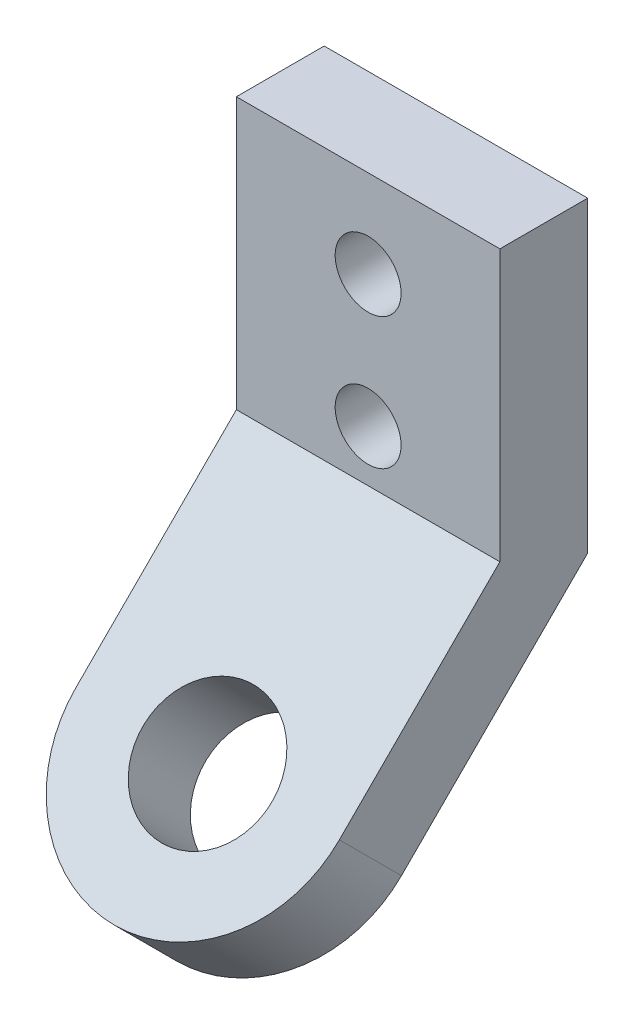
from build123d import *

# Parameters (mm, degrees)
BOSS_EXTRUDE1_DEPTH = 76.2
CUT_EXTRUDE1_DEPTH  = 267.359355894
SKETCH4_R           = 19.05
CUT_EXTRUDE2_DEPTH  = 243.798558814


with BuildPart() as part:
    # Sketch2 → Boss-Extrude1 (new body)
    with BuildSketch(Plane.YZ):
        Polygon((0, 0), (177.8, 0), (177.8, 50.8), (21.042048969, 50.8), (-125.69533605, 197.537385018), (-161.616360534, 161.616360534), align=None)
    extrude(amount=BOSS_EXTRUDE1_DEPTH)

    # Sketch3 → Cut-Extrude1 (cut, through all)
    with BuildSketch(Plane(origin=(0, 35.921024484, 35.921024484), x_dir=(-1, 0, 0), z_dir=(0, 0.7071067811865488, 0.7071067811865464))):
        with BuildLine():
            Line((-76.2, 228.560048969), (-76.2, 152.360048969))
            ThreePointArc((-76.2, 152.360048969), (-53.881536726, 206.241585695), (0, 228.560048969))
            Line((0, 228.560048969), (-76.2, 228.560048969))
        make_face()
        with BuildLine():
            Line((0, 114.895048969), (0, 189.825048969))
            ThreePointArc((0, 189.825048969), (-37.465, 152.360048969), (0, 114.895048969))
        make_face()
    extrude(amount=-CUT_EXTRUDE1_DEPTH, mode=Mode.SUBTRACT)

    # Sketch4 → Cut-Extrude2 (cut, through all)
    with BuildSketch(Plane.XY.offset(50.8)):
        with Locations((0, 127)):
            Circle(SKETCH4_R)
        with Locations((0, 50.8)):
            Circle(SKETCH4_R)
    extrude(amount=-CUT_EXTRUDE2_DEPTH, mode=Mode.SUBTRACT)

    # Mirror1: part across plane


with BuildPart() as part_1:
    add(part.part)
    add(part.part.mirror(Plane(origin=(0, 0, 0), x_dir=(0, 0, 1), z_dir=(1, 0, 0))))


solid = part_1.part
